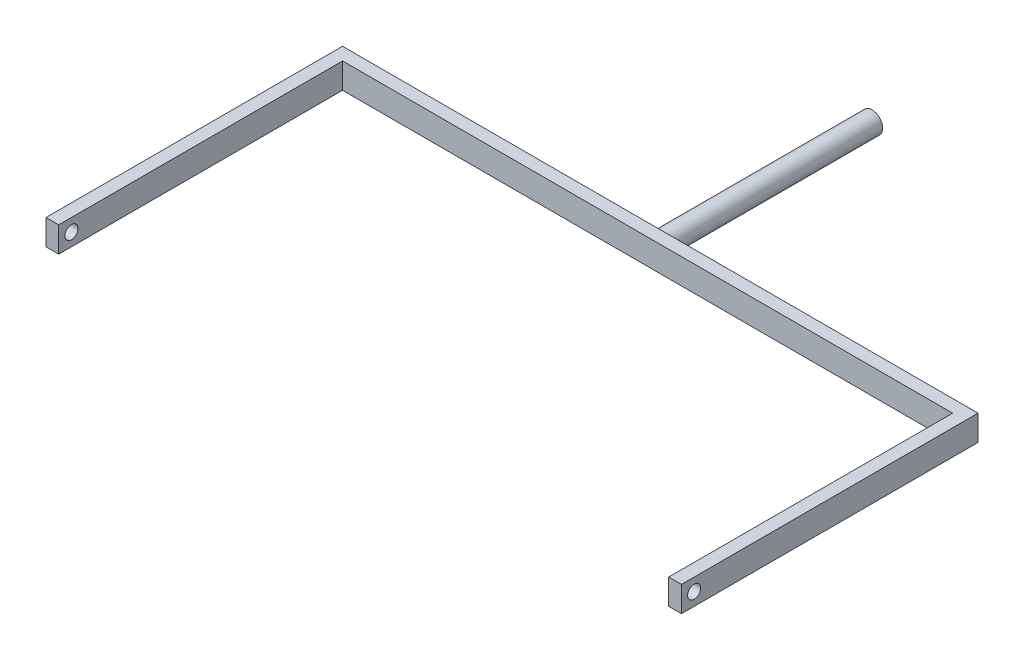
from build123d import *

# Parameters (mm, degrees)
EXTRUDE_2_DEPTH     = 6
SKETCH_2_R          = 1.55
CUT_EXTRUDE_1_DEPTH = 10
SKETCH_3_R          = 1.55
CUT_EXTRUDE_2_DEPTH = 10
SKETCH_5_R          = 2.5
EXTRUDE_3_DEPTH     = 50


with BuildPart() as part:
    # 草图1 → 凸台-拉伸2 (new body)
    with BuildSketch(Plane(origin=(0, 0, 0), x_dir=(1, 0, 0), z_dir=(0, 1, 0))):
        Polygon((-72.757575758, -68.484848485), (-72.757575758, -1.484848485), (71.242424242, -1.484848485), (71.242424242, -68.484848485), (74.242424242, -68.484848485), (74.242424242, -1.484848485), (74.242424242, 1.515151515), (71.242424242, 1.515151515), (-72.757575758, 1.515151515), (-75.757575758, 1.515151515), (-75.757575758, -1.484848485), (-75.757575758, -68.484848485), align=None)
    extrude(amount=EXTRUDE_2_DEPTH)

    # 草图2 → 切除-拉伸1 (cut)
    with BuildSketch(Plane(origin=(-72.757575758, 0, 0), x_dir=(0, 0, -1), z_dir=(1, 0, 0))):
        with Locations((-65.484848485, 3)):
            Circle(SKETCH_2_R)
    extrude(amount=-CUT_EXTRUDE_1_DEPTH, mode=Mode.SUBTRACT)

    # 草图3 → 切除-拉伸2 (cut)
    with BuildSketch(Plane(origin=(74.242424242, 0, 0), x_dir=(0, 0, -1), z_dir=(1, 0, 0))):
        with Locations((-65.484848485, 3)):
            Circle(SKETCH_3_R)
    extrude(amount=-CUT_EXTRUDE_2_DEPTH, mode=Mode.SUBTRACT)

    # 草图5 → 凸台-拉伸3 (add)
    with BuildSketch(Plane(origin=(0, 0, -1.515151515), x_dir=(-1, 0, 0), z_dir=(0, 0, -1))):
        with Locations((0.757575758, 3)):
            Circle(SKETCH_5_R)
    extrude(amount=EXTRUDE_3_DEPTH)


solid = part.part
